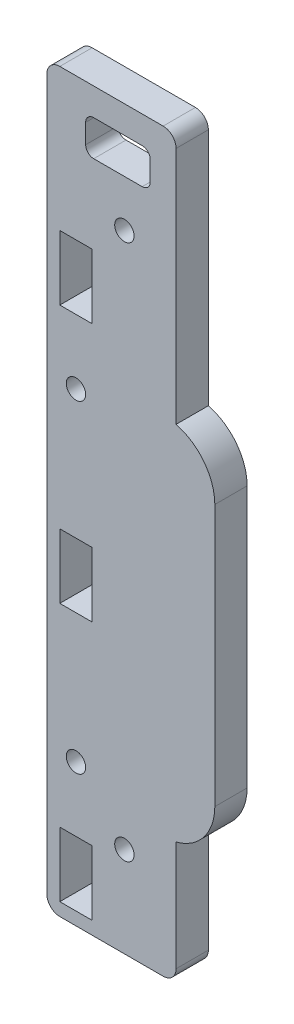
from build123d import *

# Parameters (mm, degrees)
SKETCH1_W           = 24
SKETCH1_H           = 110
SKETCH1_R           = 1.5
BOSS_EXTRUDE1_DEPTH = 5
SKETCH2_W           = 6
SKETCH2_H           = 37
SKETCH2_H_2         = 17
CUT_EXTRUDE1_DEPTH  = 113.698713391
BOSS_EXTRUDE2_DEPTH = 5
SKETCH4_R           = 1.5
SKETCH4_W           = 5
SKETCH4_H           = 10
CUT_EXTRUDE2_DEPTH  = 115.651646303
FILLET1_R           = 2
FILLET2_R           = 8
SKETCH5_W           = 7.5
SKETCH5_H           = 5.5
CUT_EXTRUDE3_DEPTH  = 115.651646303


with BuildPart() as part:
    # Sketch1 → Boss-Extrude1 (new body)
    with BuildSketch(Plane.XY):
        with Locations((12, 55)):
            Rectangle(SKETCH1_W, SKETCH1_H)
        with Locations((10, 12)):
            Circle(SKETCH1_R, mode=Mode.SUBTRACT)
        with Locations((10, 95)):
            Circle(SKETCH1_R, mode=Mode.SUBTRACT)
        with BuildLine():
            Line((4, 103.5), (4, 106.5))
            ThreePointArc((4, 106.5), (5.25, 107.75), (6.5, 106.5))
            Line((6.5, 106.5), (6.5, 103.5))
            ThreePointArc((6.5, 103.5), (5.25, 102.25), (4, 103.5))
        make_face(mode=Mode.SUBTRACT)
        with BuildLine():
            Line((11.5, 103.5), (11.5, 106.5))
            ThreePointArc((11.5, 106.5), (12.75, 107.75), (14, 106.5))
            Line((14, 106.5), (14, 103.5))
            ThreePointArc((14, 103.5), (12.75, 102.25), (11.5, 103.5))
        make_face(mode=Mode.SUBTRACT)
    extrude(amount=BOSS_EXTRUDE1_DEPTH)

    # Sketch2 → Cut-Extrude1 (cut, through all)
    with BuildSketch(Plane.XY.offset(5)):
        with Locations((21, 91.5)):
            Rectangle(SKETCH2_W, SKETCH2_H)
        with Locations((21, 8.5)):
            Rectangle(SKETCH2_W, SKETCH2_H_2)
    extrude(amount=-CUT_EXTRUDE1_DEPTH, mode=Mode.SUBTRACT)

    # Sketch3 → Boss-Extrude2 (add)
    with BuildSketch(Plane.XY.offset(5)):
        Polygon((18, -2), (18, 0), (0, 0), (0, 110), (18, 110), (18, 112), (-2, 112), (-2, -2), align=None)
    extrude(amount=-BOSS_EXTRUDE2_DEPTH)

    # Sketch4 → Cut-Extrude2 (cut, through all)
    with BuildSketch(Plane.XY.offset(5)):
        with Locations((2.5, 20)):
            Circle(SKETCH4_R)
        with Locations((2.5, 70)):
            Circle(SKETCH4_R)
        with Locations((2.5, 5)):
            Rectangle(SKETCH4_W, SKETCH4_H)
        with Locations((2.5, 85)):
            Rectangle(SKETCH4_W, SKETCH4_H)
        with Locations((2.5, 45)):
            Rectangle(SKETCH4_W, SKETCH4_H)
    extrude(amount=-CUT_EXTRUDE2_DEPTH, mode=Mode.SUBTRACT)

    # Fillet1
    fillet1_edges = [part.edges().sort_by_distance(p)[0] for p in [
        (18, 112, 2.5),
        (-2, 112, 2.5),
        (-2, -2, 2.5),
        (18, -2, 2.5),
    ]]
    fillet(fillet1_edges, radius=FILLET1_R)

    # Fillet2
    # the kernel refuses this fillet: 8 mm, written as the material it takes off along each edge
    with BuildSketch(Plane(origin=(24, 17, 24.364916731), x_dir=(0, 1, 0), z_dir=(0, 0, -1))) as fillet2_piece_1:
        with BuildLine():
            CenterArc((7.745966692, -8), FILLET2_R, 90, 75.522487814)
            Line((0, -6), (-0.154919334, -5.96))
            ThreePointArc((-0.154919334, -5.96), (-0.16, -3), (-0.16, 0))
            Line((-0.16, 0), (0, 0.16))
            Line((0, 0.16), (7.745966692, 0.16))
            Line((7.745966692, 0.16), (7.745966692, 0))
        make_face()
    extrude(amount=43.729833462, mode=Mode.SUBTRACT)
    with BuildSketch(Plane(origin=(24, 73, 24.364916731), x_dir=(-1, 0, 0), z_dir=(0, 0, -1))) as fillet2_piece_2:
        with BuildLine():
            CenterArc((8, -7.745966692), FILLET2_R, 104.477512186, 75.522487814)
            Line((0, -7.745966692), (-0.16, -7.745966692))
            Line((-0.16, -7.745966692), (-0.16, 0))
            Line((-0.16, 0), (0, 0.16))
            ThreePointArc((0, 0.16), (3, 0.16), (5.96, 0.154919334))
            Line((5.96, 0.154919334), (6, 0))
        make_face()
    extrude(amount=43.729833462, mode=Mode.SUBTRACT)

    # Sketch5 → Cut-Extrude3 (cut, through all)
    with BuildSketch(Plane.XY.offset(5)):
        with Locations((9, 105)):
            Rectangle(SKETCH5_W, SKETCH5_H)
    extrude(amount=-CUT_EXTRUDE3_DEPTH, mode=Mode.SUBTRACT)


solid = part.part
